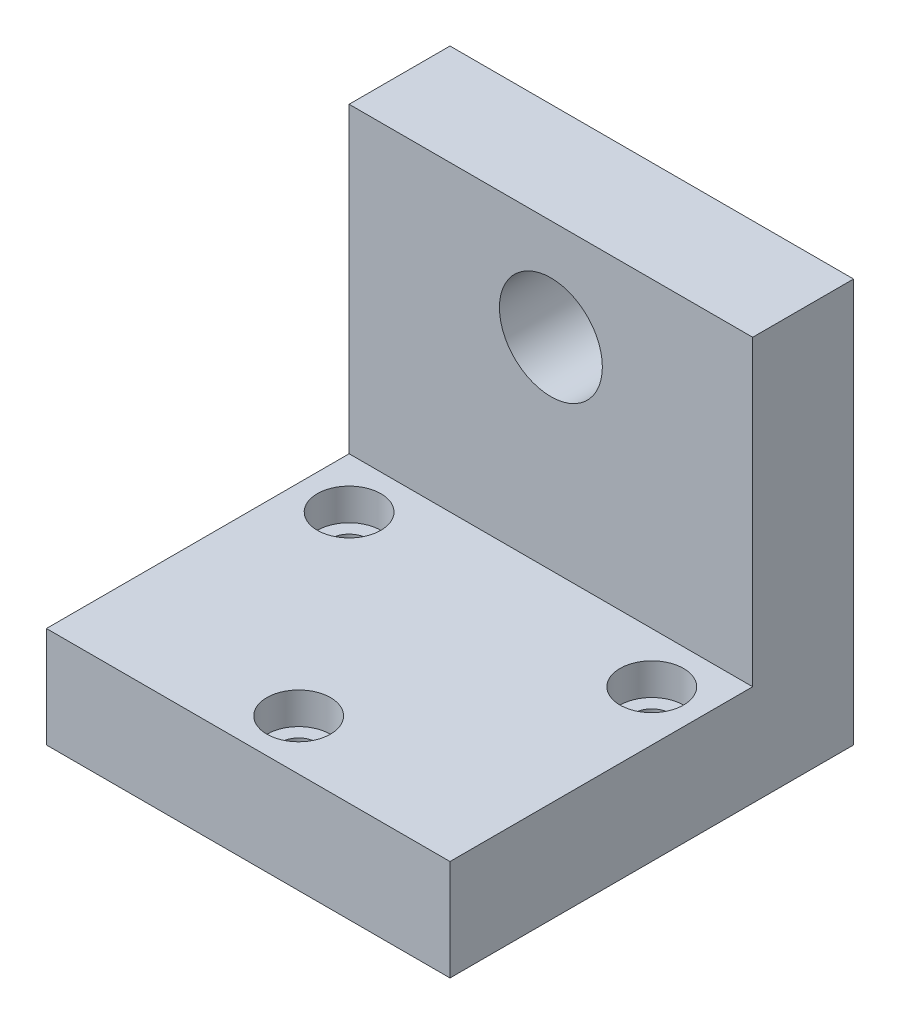
from build123d import *

# Parameters (mm, degrees)
SKETCH1_W               = 25.4
SKETCH1_H               = 25.4
BOSS_EXTRUDE1_DEPTH     = 3.175
SKETCH2_W               = 25.4
SKETCH2_H               = 6.35
BOSS_EXTRUDE2_DEPTH     = 19.05
SKETCH4_R               = 1.127000032
CUT_EXTRUDE2_DEPTH      = 39.75581408
SKETCH9_R               = 2.000000064
CUT_EXTRUDE4_DEPTH      = 2.000000064
CUT_EXTRUDE1_DEPTH      = 41.659838908
CUT_EXTRUDE1_DEPTH_BACK = 41.659838908
SKETCH3_R               = 3.2385


with BuildPart() as part:
    # Sketch1 → Boss-Extrude1 (new, symmetric)
    with BuildSketch(Plane.XY):
        with Locations((12.7, 12.7)):
            Rectangle(SKETCH1_W, SKETCH1_H)
    extrude(amount=BOSS_EXTRUDE1_DEPTH, both=True)

    # Sketch2 → Boss-Extrude2 (add)
    with BuildSketch(Plane.XY.offset(3.175)):
        with Locations((12.7, 3.175)):
            Rectangle(SKETCH2_W, SKETCH2_H)
    extrude(amount=BOSS_EXTRUDE2_DEPTH)

    # Sketch4 → Cut-Extrude2 (cut, through all)
    with BuildSketch(Plane(origin=(0, 6.35, 0), x_dir=(1, 0, 0), z_dir=(0, 1, 0))):
        with Locations((3.175, -6.35)):
            Circle(SKETCH4_R)
        with Locations((22.225, -6.35)):
            Circle(SKETCH4_R)
        with Locations((12.7, -19.05)):
            Circle(SKETCH4_R)
    extrude(amount=-CUT_EXTRUDE2_DEPTH, mode=Mode.SUBTRACT)

    # Sketch9 → Cut-Extrude4 (cut)
    with BuildSketch(Plane(origin=(0, 6.35, 0), x_dir=(1, 0, 0), z_dir=(0, 1, 0))):
        with Locations((3.175, -6.35)):
            Circle(SKETCH9_R)
        with Locations((22.225, -6.35)):
            Circle(SKETCH9_R)
        with Locations((12.7, -19.05)):
            Circle(SKETCH9_R)
    extrude(amount=-CUT_EXTRUDE4_DEPTH, mode=Mode.SUBTRACT)

    # Sketch3 → Cut-Extrude1 (cut, two sides: drawn at the far end of the back side and taken through both)
    with BuildSketch(Plane.XY.offset(3.175).offset(-CUT_EXTRUDE1_DEPTH_BACK)):
        with Locations((12.7, 19.05)):
            Circle(SKETCH3_R)
    extrude(amount=CUT_EXTRUDE1_DEPTH + CUT_EXTRUDE1_DEPTH_BACK, mode=Mode.SUBTRACT)


solid = part.part
